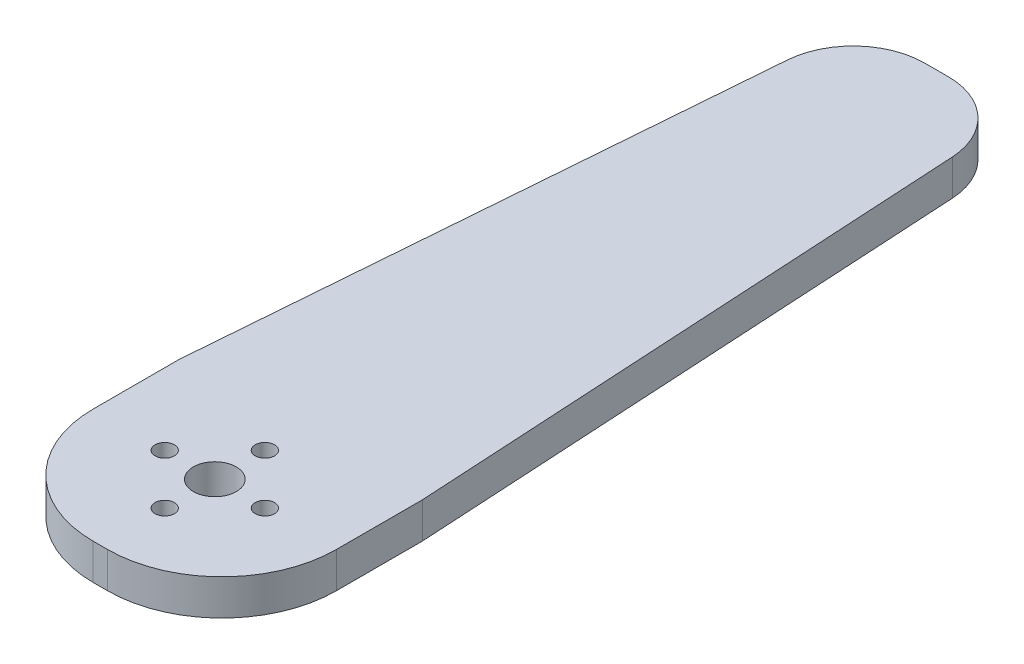
from build123d import *

# Parameters (mm, degrees)
BOSS_1_DEPTH = 5
S_HOLE2_R    = 3
HOLE_2_DEPTH = 5.2
S_HOLE3_R    = 1.35
HOLE_3_DEPTH = 5.2
S_HOLE4_R    = 1.35
HOLE_4_DEPTH = 5.2
S_HOLE5_R    = 1.35
HOLE_5_DEPTH = 5.2
S_HOLE6_R    = 1.35
HOLE_6_DEPTH = 5.2


with BuildPart() as part:
    # S_prism1 → Boss_1 (new body)
    with BuildSketch(Plane(origin=(0, -5, 0), x_dir=(1, 0, 0), z_dir=(0, 1, 0))):
        with BuildLine():
            Line((-1, -16), (1, -16))
            ThreePointArc((1, -16), (12.3137, -11.3137), (17, 0))
            Line((17, 0), (17, 12))
            Line((17, 12), (12.536, 90.5673))
            ThreePointArc((12.536, 90.5673), (9.419651018, 97.268851799), (2.5521, 100))
            Line((2.5521, 100), (-0.7639, 100))
            ThreePointArc((-0.7639, 100), (-7.548845635, 97.346057851), (-10.7324, 90.7929))
            Line((-10.7324, 90.7929), (-17, 12))
            Line((-17, 12), (-17, 0))
            ThreePointArc((-17, 0), (-12.3137, -11.3137), (-1, -16))
        make_face()
    extrude(amount=BOSS_1_DEPTH)

    # S_hole2 → Hole_2 (cut)
    with BuildSketch(Plane(origin=(0, -5.1, 0), x_dir=(1, 0, 0), z_dir=(0, 1, 0))):
        Circle(S_HOLE2_R)
    extrude(amount=HOLE_2_DEPTH, mode=Mode.SUBTRACT)

    # S_hole3 → Hole_3 (cut)
    with BuildSketch(Plane(origin=(0, -5.1, 0), x_dir=(1, 0, 0), z_dir=(0, 1, 0))):
        with Locations((7, 0)):
            Circle(S_HOLE3_R)
    extrude(amount=HOLE_3_DEPTH, mode=Mode.SUBTRACT)

    # S_hole4 → Hole_4 (cut)
    with BuildSketch(Plane(origin=(0, -5.1, 0), x_dir=(1, 0, 0), z_dir=(0, 1, 0))):
        with Locations((0, -7)):
            Circle(S_HOLE4_R)
    extrude(amount=HOLE_4_DEPTH, mode=Mode.SUBTRACT)

    # S_hole5 → Hole_5 (cut)
    with BuildSketch(Plane(origin=(0, -5.1, 0), x_dir=(1, 0, 0), z_dir=(0, 1, 0))):
        with Locations((-7, 0)):
            Circle(S_HOLE5_R)
    extrude(amount=HOLE_5_DEPTH, mode=Mode.SUBTRACT)

    # S_hole6 → Hole_6 (cut)
    with BuildSketch(Plane(origin=(0, -5.1, 0), x_dir=(1, 0, 0), z_dir=(0, 1, 0))):
        with Locations((0, 7)):
            Circle(S_HOLE6_R)
    extrude(amount=HOLE_6_DEPTH, mode=Mode.SUBTRACT)


solid = part.part
